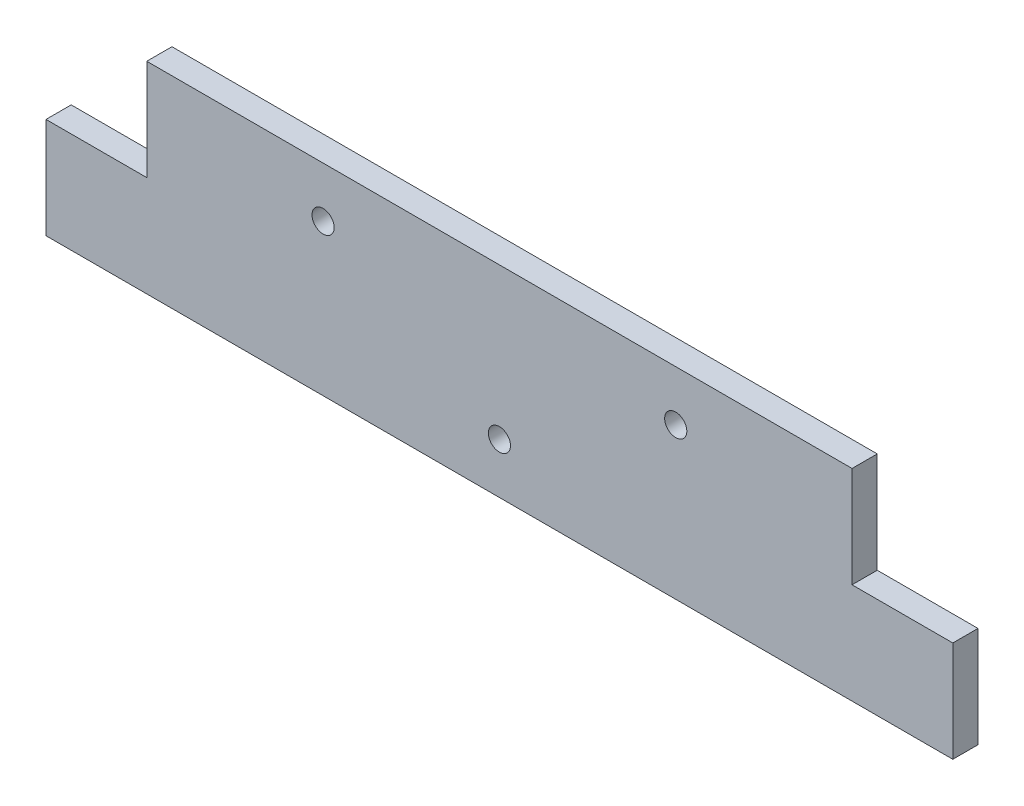
from build123d import *

# Parameters (mm, degrees)
DODANIE_WYCI_GNI_CIE1_DEPTH = 5
SZKIC2_R                    = 2.2
WYTNIJ_WYCI_GNI_CIE1_DEPTH  = 10
SZKIC6_R                    = 2.2
WYTNIJ_WYCI_GNI_CIE3_DEPTH  = 166


with BuildPart() as part:
    # Szkic1 → Dodanie-wyciągnięcie1 (new body)
    with BuildSketch(Plane.XY):
        Polygon((0, -20), (-20, -20), (-20, -40), (160, -40), (160, -20), (140, -20), (140, 0), (0, 0), align=None)
    extrude(amount=DODANIE_WYCI_GNI_CIE1_DEPTH)

    # Szkic2 → Wytnij-wyciągnięcie1 (cut)
    with BuildSketch(Plane.XY.offset(5)):
        with Locations((35, -10)):
            Circle(SZKIC2_R)
        with Locations((105, -10)):
            Circle(SZKIC2_R)
    extrude(amount=-WYTNIJ_WYCI_GNI_CIE1_DEPTH, mode=Mode.SUBTRACT)

    # Szkic6 → Wytnij-wyciągnięcie3 (cut, through all)
    with BuildSketch(Plane.XY.offset(5)):
        with Locations((70, -30)):
            Circle(SZKIC6_R)
    extrude(amount=-WYTNIJ_WYCI_GNI_CIE3_DEPTH, mode=Mode.SUBTRACT)


solid = part.part
